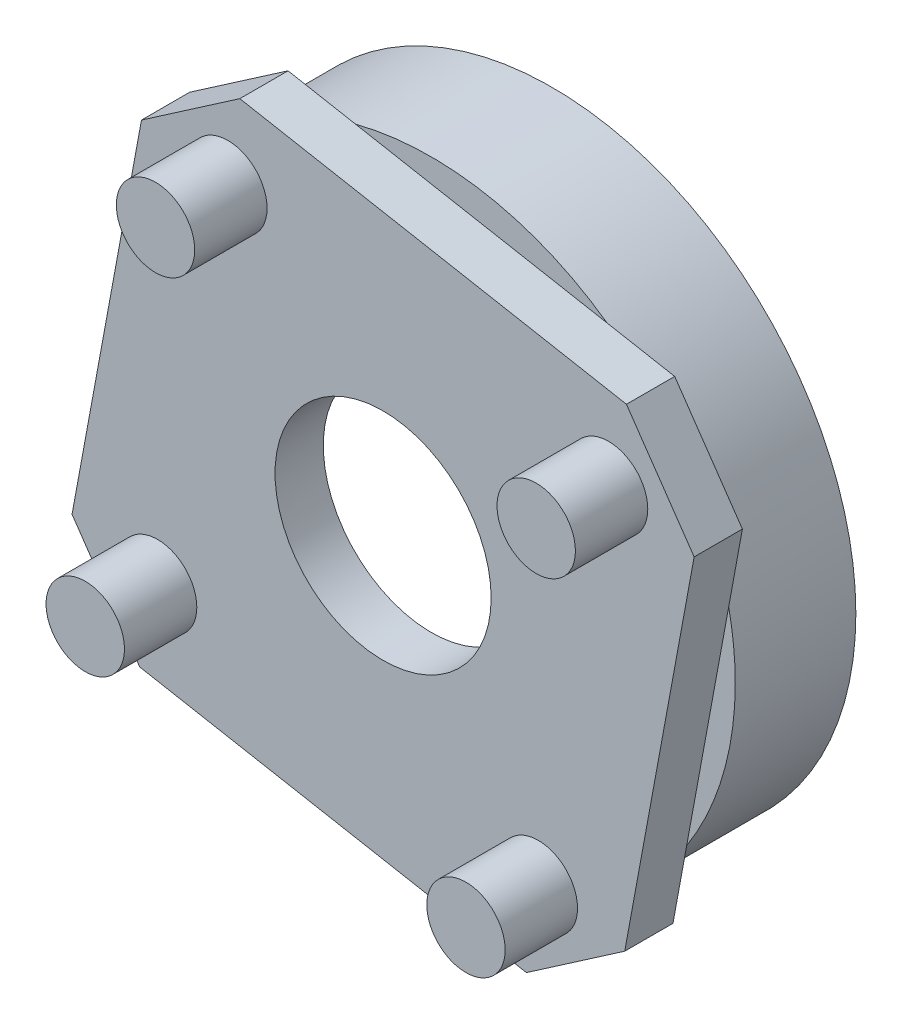
from build123d import *

# Parameters (mm, degrees)
SKETCH1_R           = 12.6
SKETCH1_R_2         = 11.1
BOSS_EXTRUDE1_DEPTH = 5
CHAMFER1_SIZE       = 1
SKETCH2_R           = 1.625
BOSS_EXTRUDE2_DEPTH = 5
BOSS_EXTRUDE3_DEPTH = 1
SKETCH4_R           = 1.625
BOSS_EXTRUDE4_DEPTH = 1
SKETCH5_R           = 4.480156316
CUT_EXTRUDE1_DEPTH  = 19.790223406


with BuildPart() as part:
    # Sketch1 → Boss-Extrude1 (new body)
    with BuildSketch(Plane.XY):
        Circle(SKETCH1_R)
        Circle(SKETCH1_R_2, mode=Mode.SUBTRACT)
    extrude(amount=-BOSS_EXTRUDE1_DEPTH)

    # Chamfer1
    chamfer1_edges = [part.edges().sort_by_distance(p)[0] for p in [
        (-11.1, 0, -5),
    ]]
    chamfer(chamfer1_edges, length=CHAMFER1_SIZE)

    # Sketch2 → Boss-Extrude2 (add)
    with BuildSketch(Plane.XY):
        with Locations((-9.347993341, -6.435547413)):
            Circle(SKETCH2_R)
        with Locations((6.435547413, -9.347993341)):
            Circle(SKETCH2_R)
        with Locations((9.347993341, 6.435547413)):
            Circle(SKETCH2_R)
        with Locations((-6.435547413, 9.347993341)):
            Circle(SKETCH2_R)
    extrude(amount=BOSS_EXTRUDE2_DEPTH)

    # Sketch3 → Boss-Extrude3 (add)
    with BuildSketch(Plane.XY):
        Polygon((12.895572959, 5.684329166), (10.088792155, 9.761335608), (-5.940598143, 12.719146737), (-10.017604584, 9.912365933), (-12.895572959, -5.684329166), (-10.088792155, -9.761335608), (5.940598143, -12.719146737), (10.017604584, -9.912365933), align=None)
    extrude(amount=BOSS_EXTRUDE3_DEPTH)

    # Sketch4 → Boss-Extrude4 (add)
    with BuildSketch(Plane.XY.offset(1)):
        Polygon((-5.940598143, 12.719146737), (-10.017604584, 9.912365933), (-12.895572959, -5.684329166), (-10.088792155, -9.761335608), (5.940598143, -12.719146737), (10.017604584, -9.912365933), (12.895572959, 5.684329166), (10.088792155, 9.761335608), align=None)
        with Locations((-6.435547413, 9.347993341)):
            Circle(SKETCH4_R, mode=Mode.SUBTRACT)
        with Locations((9.347993341, 6.435547413)):
            Circle(SKETCH4_R, mode=Mode.SUBTRACT)
        with Locations((6.435547413, -9.347993341)):
            Circle(SKETCH4_R, mode=Mode.SUBTRACT)
        with Locations((-9.347993341, -6.435547413)):
            Circle(SKETCH4_R, mode=Mode.SUBTRACT)
    extrude(amount=BOSS_EXTRUDE4_DEPTH)

    # Sketch5 → Cut-Extrude1 (cut, through all)
    with BuildSketch(Plane.XY):
        Circle(SKETCH5_R)
    extrude(amount=CUT_EXTRUDE1_DEPTH, mode=Mode.SUBTRACT)


solid = part.part
